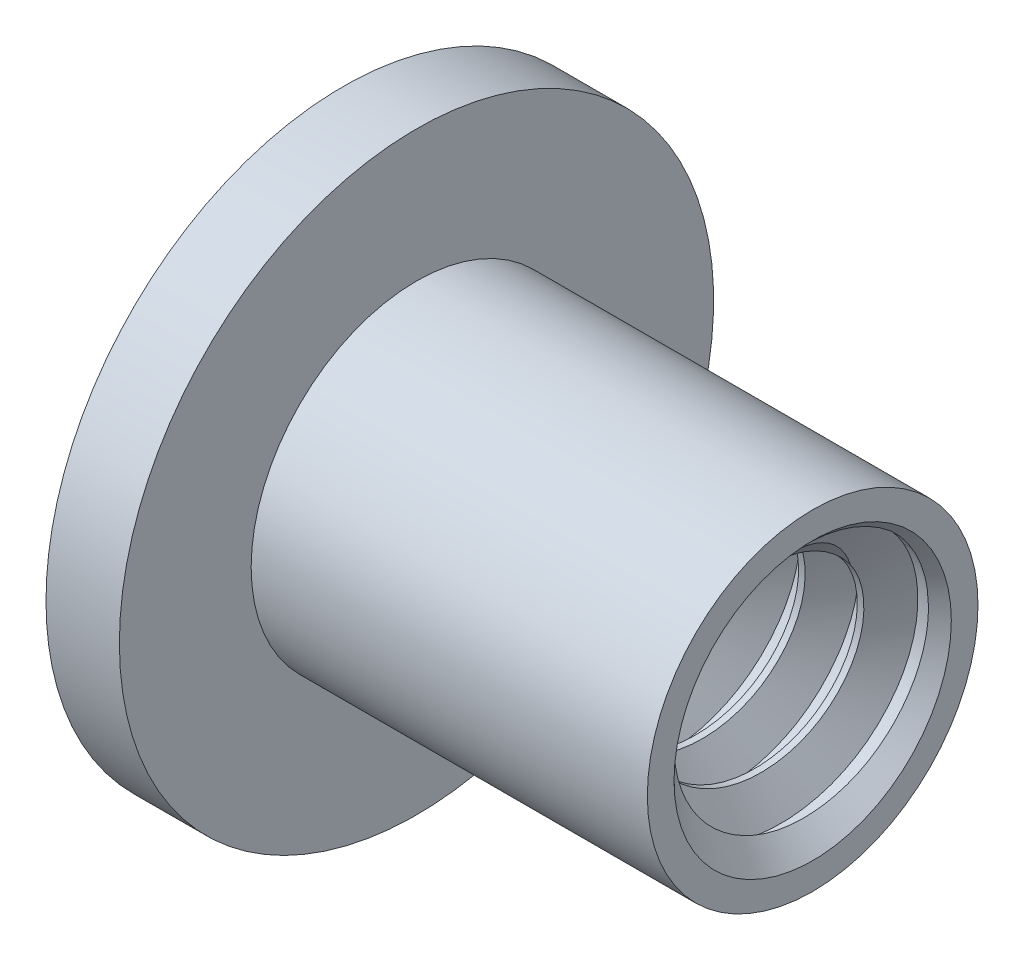
from build123d import *

# Parameters (mm, degrees)
SKETCH17_W                   = 14.2875
SKETCH17_H                   = 2.8575
CUT_EXTRUDE5_DEPTH           = 2.204861
SKETCH18_W                   = 2.8575
SKETCH18_H                   = 6.985
CUT_EXTRUDE6_DEPTH           = 11.323664257
CUT_EXTRUDE6_OTHER_WAY_DEPTH = 1.322917
CUT_EXTRUDE6_OTHER_WAY_TAPER = 30
SKETCH19_W                   = 6.985
SKETCH19_H                   = 2.8575
CUT_EXTRUDE7_DEPTH           = 1.322917
CUT_EXTRUDE7_DRAFT           = -30
SKETCH11_R                   = 3.9751
SKETCH11_R_2                 = 3.175
BOSS_EXTRUDE3_DEPTH          = 9.525
BOSS_EXTRUDE4_START          = -4.7625
SKETCH21_R                   = 3.175
BOSS_EXTRUDE4_DEPTH          = 4.7625
CUT_SWEEP1_PITCH             = 1.411111111
SKETCH22_R                   = 3.175
BOSS_EXTRUDE6_DEPTH          = 4.7625


with BuildPart() as part:
    # Sketch6 → Revolve1 (revolve)
    with BuildSketch(Plane.XY):
        with BuildLine():
            Line((7.9375, 0), (7.9375, 7.14375))
            Line((7.9375, 7.14375), (9.701388889, 7.14375))
            ThreePointArc((9.701388889, 7.14375), (11.342497887, 3.738133778), (11.90625, 0))
            Line((11.90625, 0), (7.9375, 0))
        make_face()
    revolve(axis=Axis((7.9375, 0, 0), (1, 0, 0)))

    # Sketch17 → Cut-Extrude5 (cut)
    with BuildSketch(Plane(origin=(11.90625, 0, 0), x_dir=(0, 0, -1), z_dir=(1, 0, 0))):
        Rectangle(SKETCH17_W, SKETCH17_H)
    extrude(amount=-CUT_EXTRUDE5_DEPTH, mode=Mode.SUBTRACT)

    # Sketch18 → Cut-Extrude6 (cut)
    with BuildSketch(Plane(origin=(9.701388889, 0, 0), x_dir=(0, 0, -1), z_dir=(1, 0, 0))):
        Rectangle(SKETCH18_W, SKETCH18_H)
    extrude(amount=CUT_EXTRUDE6_DEPTH, mode=Mode.SUBTRACT)

    # Sketch18 → Cut-Extrude6 other way (cut)
    with BuildSketch(Plane(origin=(9.701388889, 0, 0), x_dir=(0, 0, -1), z_dir=(1, 0, 0))):
        Rectangle(SKETCH18_W, SKETCH18_H)
    extrude(amount=-CUT_EXTRUDE6_OTHER_WAY_DEPTH, taper=CUT_EXTRUDE6_OTHER_WAY_TAPER, mode=Mode.SUBTRACT)


with BuildPart() as cut_extrude7_tool:
    # Sketch19 → Cut-Extrude7 (with draft: the straight prism first)
    with BuildSketch(Plane(origin=(9.701388889, 0, 0), x_dir=(0, 0, -1), z_dir=(1, 0, 0))):
        Rectangle(SKETCH19_W, SKETCH19_H)
    extrude(amount=-CUT_EXTRUDE7_DEPTH)
    # Cut-Extrude7: the draft: its side faces are tilted about the plane it starts from
    cut_extrude7_sides = [cut_extrude7_tool.faces().sort_by_distance(p)[0] for p in [
        (9.039930389, 0, 3.4925),
        (9.039930389, -1.42875, 0),
        (9.039930389, 0, -3.4925),
        (9.039930389, 1.42875, 0),
    ]]
    draft(cut_extrude7_sides, Plane(origin=(9.701388889, 0, 0), x_dir=(0, 0, -1), z_dir=(1, 0, 0)), CUT_EXTRUDE7_DRAFT)


with BuildPart() as part_1:
    add(part.part)

    # Cut-Extrude7: cut by cut_extrude7_tool
    add(cut_extrude7_tool.part, mode=Mode.SUBTRACT)


with BuildPart() as body_2:
    # Mirror1: mirrored copy
    add(part_1.part.mirror(Plane(origin=(-3.96875, 0, 0), x_dir=(0, 0, 1), z_dir=(1, 0, 0))))

    # Sketch11 → Boss-Extrude3 (add)
    with BuildSketch(Plane(origin=(-6.35, 0, 0), x_dir=(0, 0, -1), z_dir=(1, 0, 0))):
        Circle(SKETCH11_R)
        Circle(SKETCH11_R_2, mode=Mode.SUBTRACT)
    extrude(amount=-BOSS_EXTRUDE3_DEPTH)

    # Sketch22 → Boss-Extrude6 (add)
    with BuildSketch(Plane(origin=(-6.35, 0, 0), x_dir=(0, 0, -1), z_dir=(1, 0, 0))):
        Circle(SKETCH22_R)
    extrude(amount=-BOSS_EXTRUDE6_DEPTH)


with BuildPart() as body_2_2:
    # Sketch21 → Boss-Extrude4 (new body)
    with BuildSketch(Plane(origin=(-6.35, 0, 0), x_dir=(0, 0, -1), z_dir=(1, 0, 0)).offset(BOSS_EXTRUDE4_START)):
        Circle(SKETCH21_R)
    extrude(amount=BOSS_EXTRUDE4_DEPTH)

    # Cut-Sweep1: the profile of Sketch13 profile screwed along a right-hand helix of 4.375 turns, 8 arcs to a turn; built about Z, then put on its axis
    cut_sweep1_z = Axis((0, 0, 0), (0, 0, 1))
    cut_sweep1_corners = [(3.1753, 0, -1.111423205), (3.1753, 0, 0.000173205), (2.350110803, 0, -0.47625), (2.350110803, 0, -0.635)]
    with BuildLine(mode=Mode.PRIVATE) as cut_sweep1_profile:
        Line(cut_sweep1_corners[0], cut_sweep1_corners[1])
        Line(cut_sweep1_corners[1], cut_sweep1_corners[2])
        Line(cut_sweep1_corners[2], cut_sweep1_corners[3])
        Line(cut_sweep1_corners[3], cut_sweep1_corners[0])
    cut_sweep1_cap = Face(cut_sweep1_profile.wire())
    cut_sweep1_turn_angles = [0, 22.5, 45, 67.5, 90, 112.5, 135, 157.5, 180, 202.5, 225, 247.5, 270, 292.5, 315, 337.5, 360]
    cut_sweep1_turn_weights = [1, 0.9238795325112867, 1, 0.9238795325112867, 1, 0.9238795325112867, 1, 0.9238795325112867, 1, 0.9238795325112867, 1, 0.9238795325112867, 1, 0.9238795325112867, 1, 0.9238795325112867, 1]
    cut_sweep1_turn_rails = [Edge.make_bspline([Vector(p[0], p[1], 0).rotate(cut_sweep1_z, cut_sweep1_turn_angles[k]) / cut_sweep1_turn_weights[k] + Vector(0, 0, p[2] + CUT_SWEEP1_PITCH * cut_sweep1_turn_angles[k] / 360) for k in range(17)], [0, 0, 0, 1, 1, 2, 2, 3, 3, 4, 4, 5, 5, 6, 6, 7, 7, 8, 8, 8], 2, cut_sweep1_turn_weights) for p in cut_sweep1_corners]
    cut_sweep1_turn_sides = [Face.make_surface_from_curves(cut_sweep1_turn_rails[p[0]], cut_sweep1_turn_rails[p[1]]) for p in [(0, 1), (1, 2), (2, 3), (3, 0)]]
    cut_sweep1_last_angles = [1440, 1462.5, 1485, 1507.5, 1530, 1552.5, 1575]
    cut_sweep1_last_weights = [1, 0.9238795325112867, 1, 0.9238795325112867, 1, 0.9238795325112754, 1]
    cut_sweep1_last_rails = [Edge.make_bspline([Vector(p[0], p[1], 0).rotate(cut_sweep1_z, cut_sweep1_last_angles[k]) / cut_sweep1_last_weights[k] + Vector(0, 0, p[2] + CUT_SWEEP1_PITCH * cut_sweep1_last_angles[k] / 360) for k in range(7)], [0, 0, 0, 1, 1, 2, 2, 3, 3, 3], 2, cut_sweep1_last_weights) for p in cut_sweep1_corners]
    cut_sweep1_last_sides = [Face.make_surface_from_curves(cut_sweep1_last_rails[p[0]], cut_sweep1_last_rails[p[1]]) for p in [(0, 1), (1, 2), (2, 3), (3, 0)]]
    cut_sweep1 = Plane(origin=(-6.35, 0, 0), x_dir=(0, 1, 0), z_dir=(-1, 0, 0)) * Solid(Shell([*[p.moved(Location((0, 0, CUT_SWEEP1_PITCH * i))) for i in range(4) for p in cut_sweep1_turn_sides], *cut_sweep1_last_sides, cut_sweep1_cap, cut_sweep1_cap.rotate(cut_sweep1_z, 1575).moved(Location((0, 0, CUT_SWEEP1_PITCH * 1575 / 360)))]))
    add(cut_sweep1, mode=Mode.SUBTRACT)

    # Boss-Extrude5 cone 1 section (through the dimple's axis) → Boss-Extrude5 (revolve)
    with BuildSketch(Plane(origin=(-6.35, 0, 0), x_dir=(0, 0, -1), z_dir=(0, 1, 0))):
        Polygon((0, 0), (3.33375, 0), (0, 3.33375), align=None)
    revolve(axis=Axis((-6.35, 0, 0), (-1, 0, 0)))


with BuildPart() as body_2_1:
    add(body_2.part)

    # Combine1: cut body 2 2
    add(body_2_2.part, mode=Mode.SUBTRACT)


solid = body_2_1.part
